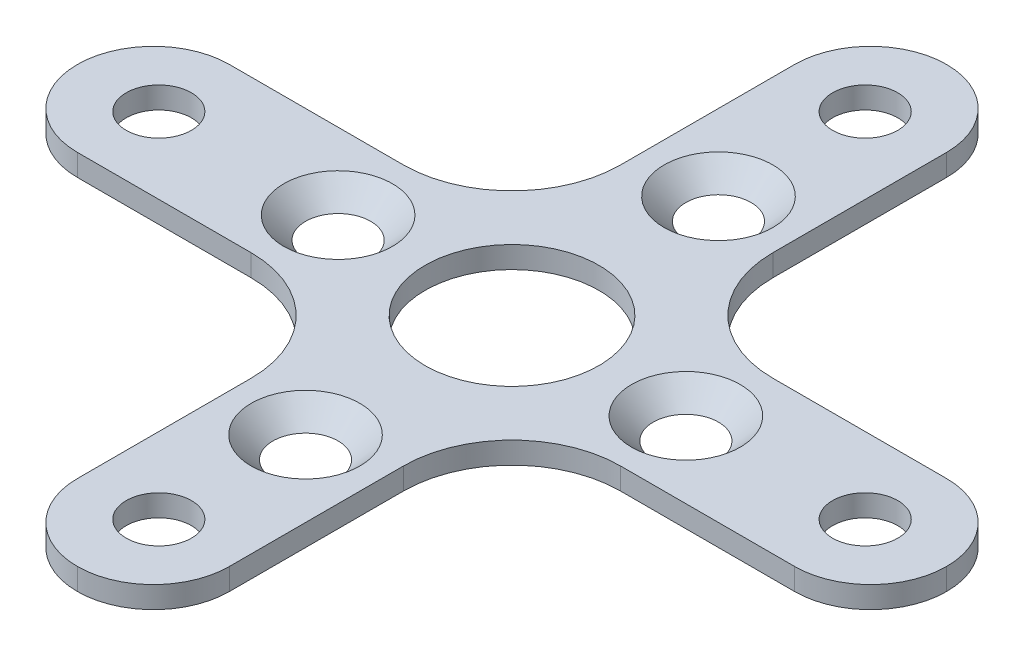
from build123d import *

# Parameters (mm, degrees)
SKETCH1_W           = 3.5
SKETCH1_H           = 3.5
BOSS_EXTRUDE1_DEPTH = 1
FILLET1_R           = 5
FILLET2_R           = 3.5
CUT_EXTRUDE1_REACH  = 30.302
SKETCH2_R           = 4
CHAMFER1_SIZE       = 1


with BuildPart() as part:
    # Sketch1 → Boss-Extrude1 (new body)
    with BuildSketch(Plane(origin=(0, 0, 0), x_dir=(1, 0, 0), z_dir=(0, 1, 0))):
        with BuildLine():
            Line((-6.5, 0), (-3.5, 0))
            Line((-3.5, 0), (-3.5, 3.5))
            Line((-3.5, 3.5), (-20, 3.5))
            Line((-20, 3.5), (-20, 0))
            Line((-20, 0), (-17.75, 0))
            ThreePointArc((-17.75, 0), (-16.25, 1.5), (-14.75, 0))
            Line((-14.75, 0), (-9.5, 0))
            ThreePointArc((-9.5, 0), (-8, 1.5), (-6.5, 0))
        make_face()
        with BuildLine():
            Line((-20, -3.5), (-3.5, -3.5))
            Line((-3.5, -3.5), (-3.5, 0))
            Line((-3.5, 0), (-6.5, 0))
            ThreePointArc((-6.5, 0), (-8, -1.5), (-9.5, 0))
            Line((-9.5, 0), (-14.75, 0))
            ThreePointArc((-14.75, 0), (-16.25, -1.5), (-17.75, 0))
            Line((-17.75, 0), (-20, 0))
            Line((-20, 0), (-20, -3.5))
        make_face()
        with BuildLine():
            Line((-3.5, 20), (-3.5, 3.5))
            Line((-3.5, 3.5), (0, 3.5))
            Line((0, 3.5), (0, 8))
            ThreePointArc((0, 8), (-1.5, 9.5), (0, 11))
            Line((0, 11), (0, 14.75))
            ThreePointArc((0, 14.75), (-1.5, 16.25), (0, 17.75))
            Line((0, 17.75), (0, 20))
            Line((0, 20), (-3.5, 20))
        make_face()
        with BuildLine():
            Line((0, 3.5), (3.5, 3.5))
            Line((3.5, 3.5), (3.5, 20))
            Line((3.5, 20), (0, 20))
            Line((0, 20), (0, 17.75))
            ThreePointArc((0, 17.75), (1.060660172, 17.310660172), (1.5, 16.25))
            ThreePointArc((1.5, 16.25), (1.060660172, 15.189339828), (0, 14.75))
            Line((0, 14.75), (0, 11))
            ThreePointArc((0, 11), (1.060660172, 10.560660172), (1.5, 9.5))
            ThreePointArc((1.5, 9.5), (1.060660172, 8.439339828), (0, 8))
            Line((0, 8), (0, 3.5))
        make_face()
        with BuildLine():
            Line((3.5, 3.5), (3.5, 0))
            Line((3.5, 0), (6.5, 0))
            ThreePointArc((6.5, 0), (8, 1.5), (9.5, 0))
            Line((9.5, 0), (14.75, 0))
            ThreePointArc((14.75, 0), (16.25, 1.5), (17.75, 0))
            Line((17.75, 0), (20, 0))
            Line((20, 0), (20, 3.5))
            Line((20, 3.5), (3.5, 3.5))
        make_face()
        with Locations((-1.75, 1.75)):
            Rectangle(SKETCH1_W, SKETCH1_H)
        with Locations((-1.75, -1.75)):
            Rectangle(SKETCH1_W, SKETCH1_H)
        with Locations((1.75, -1.75)):
            Rectangle(SKETCH1_W, SKETCH1_H)
        with Locations((1.75, 1.75)):
            Rectangle(SKETCH1_W, SKETCH1_H)
        with BuildLine():
            Line((-3.5, -20), (0, -20))
            Line((0, -20), (0, -17.75))
            ThreePointArc((0, -17.75), (-1.5, -16.25), (0, -14.75))
            Line((0, -14.75), (0, -11))
            ThreePointArc((0, -11), (-1.5, -9.5), (0, -8))
            Line((0, -8), (0, -3.5))
            Line((0, -3.5), (-3.5, -3.5))
            Line((-3.5, -3.5), (-3.5, -20))
        make_face()
        with BuildLine():
            Line((0, -17.75), (0, -20))
            Line((0, -20), (3.5, -20))
            Line((3.5, -20), (3.5, -3.5))
            Line((3.5, -3.5), (0, -3.5))
            Line((0, -3.5), (0, -8))
            ThreePointArc((0, -8), (1.060660172, -8.439339828), (1.5, -9.5))
            ThreePointArc((1.5, -9.5), (1.060660172, -10.560660172), (0, -11))
            Line((0, -11), (0, -14.75))
            ThreePointArc((0, -14.75), (1.060660172, -15.189339828), (1.5, -16.25))
            ThreePointArc((1.5, -16.25), (1.060660172, -17.310660172), (0, -17.75))
        make_face()
        with BuildLine():
            Line((3.5, 0), (3.5, -3.5))
            Line((3.5, -3.5), (20, -3.5))
            Line((20, -3.5), (20, 0))
            Line((20, 0), (17.75, 0))
            ThreePointArc((17.75, 0), (16.25, -1.5), (14.75, 0))
            Line((14.75, 0), (9.5, 0))
            ThreePointArc((9.5, 0), (8, -1.5), (6.5, 0))
            Line((6.5, 0), (3.5, 0))
        make_face()
    extrude(amount=BOSS_EXTRUDE1_DEPTH)

    # Fillet1
    fillet1_edges = [part.edges().sort_by_distance(p)[0] for p in [
        (-3.5, 0.5, -3.5),
        (3.5, 0.5, -3.5),
        (3.5, 0.5, 3.5),
        (-3.5, 0.5, 3.5),
    ]]
    fillet(fillet1_edges, radius=FILLET1_R)

    # Fillet2
    fillet2_edges = [part.edges().sort_by_distance(p)[0] for p in [
        (20, 0.5, 3.5),
        (20, 0.5, -3.5),
        (3.5, 0.5, -20),
        (-3.5, 0.5, -20),
        (-20, 0.5, -3.5),
        (-20, 0.5, 3.5),
        (3.5, 0.5, 20),
        (-3.5, 0.5, 20),
    ]]
    fillet(fillet2_edges, radius=FILLET2_R - 0.0001)  # a hair under: the kernel refuses the full size

    # Sketch2 → Cut-Extrude1 (cut, up to next)
    with BuildSketch(Plane(origin=(0, 1, 0), x_dir=(1, 0, 0), z_dir=(0, 1, 0)), mode=Mode.PRIVATE) as cut_extrude1_sk1:
        with Locations(Location((0, 0, 0), (0, 0, 270))):
            Circle(SKETCH2_R)
    cut_extrude1_tool1 = extrude(cut_extrude1_sk1.sketch, amount=-CUT_EXTRUDE1_REACH, mode=Mode.PRIVATE) & part.part
    add(cut_extrude1_tool1.solids().sort_by_distance((0, 1, 0))[0], mode=Mode.SUBTRACT)

    # Chamfer1
    chamfer1_edges = [part.edges().sort_by_distance(p)[0] for p in [
        (0, 1, 11),
        (6.5, 1, 0),
        (-6.5, 1, 0),
        (0, 1, -11),
    ]]
    chamfer(chamfer1_edges, length=CHAMFER1_SIZE - 0.0001)  # a hair under: the kernel refuses the full size


solid = part.part
